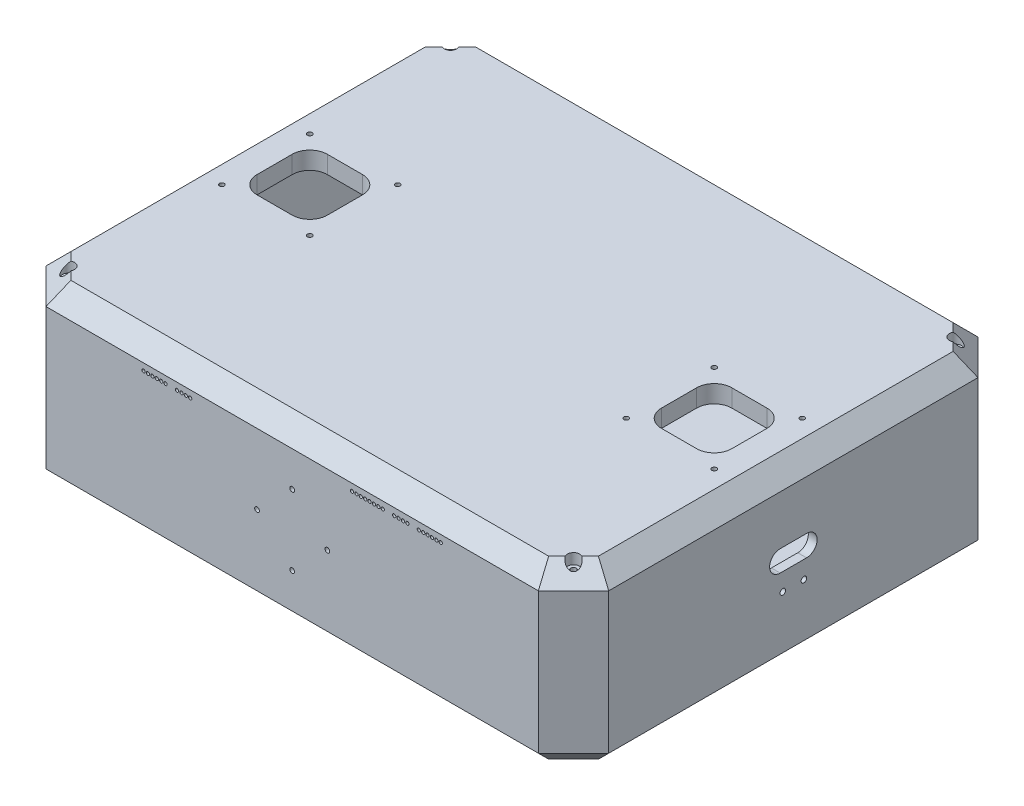
from build123d import *

# Parameters (mm, degrees)
BOSS_EXTRUDE1_DEPTH     = 50
CHAMFER1_SIZE           = 20
CHAMFER2_SIZE           = 10
SHELL1_T                = -5
CUT_EXTRUDE1_DEPTH      = 210.10523666326498
CUT_EXTRUDE1_DEPTH_BACK = 210.10523666326498
SKETCH3_R               = 1.3500000000000005
SKETCH3_R_2             = 1.3500000000000056
SKETCH3_R_3             = 1.3499999999999985
BOSS_EXTRUDE2_DEPTH     = 85
BOSS_EXTRUDE2_2_DEPTH   = 85
SKETCH4_W               = 8
SKETCH4_H               = 8
BOSS_EXTRUDE2_3_DEPTH   = 85
SKETCH5_W               = 6
SKETCH5_H               = 6
CUT_EXTRUDE2_DEPTH      = 8
CHAMFER3_SIZE           = 8
CHAMFER4_SIZE           = 8
CHAMFER5_SIZE           = 8
CHAMFER6_SIZE           = 0.5
CHAMFER7_SIZE           = 0.5
CHAMFER8_SIZE           = 0.5
BOSS_EXTRUDE4_DEPTH     = 8
SKETCH6_R               = 5
SKETCH6_R_2             = 5.000000000000004
SKETCH6_R_3             = 5.000000000000002
BOSS_EXTRUDE3_DEPTH     = 1.5
CHAMFER9_SIZE           = 0.5
SKETCH7_R               = 6
CUT_EXTRUDE3_DEPTH      = 343.5638626592129
CHAMFER10_SIZE          = 8
SKETCH9_R               = 1.6
CUT_EXTRUDE4_DEPTH      = 343.56386265921293
BOSS_EXTRUDE5_DEPTH     = 12
CHAMFER11_SIZE          = 8
FILLET1_R               = 1
SKETCH11_R              = 1.599999999999993
CUT_EXTRUDE6_DEPTH      = 223.09232314512823
CUT_EXTRUDE7_START      = 4
SKETCH11_3_R            = 3.500000000000021
SKETCH11_3_R_2          = 1.599999999999993
CUT_EXTRUDE7_DEPTH      = 6
SKETCH14_R              = 0.9250000000000028
SKETCH14_R_2            = 0.9250000000000008
CUT_EXTRUDE8_DEPTH      = 301.9983388658483
SKETCH15_R              = 1.3500000000000065
SKETCH15_R_2            = 1.3500000000000054
SKETCH15_R_3            = 1.3499999999999779
CUT_EXTRUDE9_DEPTH      = 10
FILLET2_R               = 10


# Read off the part's stored shape, not the designer's step: Intersect1
# Some blends are built 0.0001 mm under size
with BuildPart() as part:
    # Sketch1 → Boss-Extrude1 (new, symmetric)
    with BuildSketch(Plane(origin=(0, 0, 0), x_dir=(1, 0, 0), z_dir=(0, 1, 0))):
        Polygon((-159.99999999999997, 125.00000000000003), (160.00000000000003, 125.00000000000003), (160.0000000000001, -124.99999999999997), (-159.99999999999994, -124.99999999999997), align=None)
    extrude(amount=BOSS_EXTRUDE1_DEPTH, both=True)

    # Chamfer1
    chamfer1_edges = [part.edges().sort_by_distance(p)[0] for p in [
        (160.0000000000001, 0, 124.99999999999997),
        (-159.99999999999994, 0, 124.99999999999997),
        (-159.99999999999997, 0, -125.00000000000003),
        (160.00000000000003, 0, -125.00000000000003),
    ]]
    chamfer(chamfer1_edges, length=CHAMFER1_SIZE)

    # Chamfer2
    chamfer2_edges = [part.edges().sort_by_distance(p)[0] for p in [
        (-159.99999999999994, -50, -2.842e-14),
        (-159.99999999999994, 50, -2.842e-14),
        (160.00000000000006, -50, -2.842e-14),
        (8.527e-14, -50, 124.99999999999997),
        (2.842e-14, -50, -125.00000000000003),
        (150.0000000000001, -50.000000000000014, 114.99999999999999),
        (150.00000000000006, -50.000000000000014, -115.00000000000004),
        (-149.99999999999994, -50, 114.99999999999997),
        (-150, -50, -115.00000000000006),
        (2.842e-14, 50, -125.00000000000003),
        (160.00000000000006, 50, -2.842e-14),
        (8.527e-14, 50, 124.99999999999997),
        (150.0000000000001, 50, 114.99999999999999),
        (150.00000000000006, 50, -115.00000000000004),
        (-149.99999999999994, 50.000000000000014, 114.99999999999997),
        (-150, 50.000000000000014, -115.00000000000006),
    ]]
    chamfer(chamfer2_edges, length=CHAMFER2_SIZE)


with BuildPart() as body_2:
    # Intersect1: the piece on the far side of the plane
    add(part.part)
    split(bisect_by=Plane(origin=(0, 40, 0), x_dir=(1, 0, 0), z_dir=(0, 1, 0)), keep=Keep.BOTTOM)

    # Shell1
    shell1_openings = [body_2.faces().sort_by_distance(p)[0] for p in [
        (0, 40, 0),
    ]]
    offset(amount=SHELL1_T, openings=shell1_openings, kind=Kind.INTERSECTION)

    # Sketch3 → Cut-Extrude1 (cut, two sides: drawn at the far end of the back side and taken through both)
    with BuildSketch(Plane.XY.offset(-CUT_EXTRUDE1_DEPTH_BACK)):
        with Locations((3.96e-15, 20.000000000000004)):
            Circle(SKETCH3_R)
        with Locations((20.000000000000004, -3.47e-15)):
            Circle(SKETCH3_R_2)
        with Locations((2.98e-15, -20.000000000000004)):
            Circle(SKETCH3_R)
        with Locations((-19.999999999999996, 1.276e-14)):
            Circle(SKETCH3_R_3)
    extrude(amount=CUT_EXTRUDE1_DEPTH + CUT_EXTRUDE1_DEPTH_BACK, mode=Mode.SUBTRACT)


with BuildPart() as part_1:
    add(part.part)

    # Intersect1
    split(bisect_by=Plane(origin=(0, 40, 0), x_dir=(1, 0, 0), z_dir=(0, 1, 0)), keep=Keep.TOP)

    # Sketch11 → Cut-Extrude6 (cut, through all)
    with BuildSketch(Plane(origin=(0, 40, 0), x_dir=(1, 0, 0), z_dir=(0, 1, 0))):
        with Locations(Location((143.6360389693211, 108.63603896932109, 0), (0, 0, 173.682187454))):
            Circle(SKETCH11_R)
        with Locations(Location((143.6360389693211, -108.63603896932109, 0), (0, 0, 83.682187454))):
            Circle(SKETCH11_R)
        with Locations(Location((-143.6360389693211, -108.63603896932109, 0), (0, 0, 96.317812547))):
            Circle(SKETCH11_R)
        with Locations(Location((-143.6360389693211, 108.63603896932109, 0), (0, 0, 6.317812547))):
            Circle(SKETCH11_R)
    extrude(amount=CUT_EXTRUDE6_DEPTH, mode=Mode.SUBTRACT)

    # Sketch11<3> → Cut-Extrude7 (cut)
    # profile 1 of 4: a face of its own
    with BuildSketch(Plane(origin=(0, 40, 0), x_dir=(1, 0, 0), z_dir=(0, 1, 0)).offset(CUT_EXTRUDE7_START)):
        with Locations(Location((-143.6360389693211, 108.63603896932109, 0), (0, 0, 270))):
            Circle(SKETCH11_3_R)
        with Locations(Location((-143.6360389693211, 108.63603896932109, 0), (0, 0, 270))):
            Circle(SKETCH11_3_R_2, mode=Mode.SUBTRACT)
    # profile 2 of 4: a face of its own
    with BuildSketch(Plane(origin=(0, 40, 0), x_dir=(1, 0, 0), z_dir=(0, 1, 0)).offset(CUT_EXTRUDE7_START)):
        with Locations(Location((143.6360389693211, 108.63603896932109, 0), (0, 0, 270))):
            Circle(SKETCH11_3_R)
        with Locations(Location((143.6360389693211, 108.63603896932109, 0), (0, 0, 270))):
            Circle(SKETCH11_3_R_2, mode=Mode.SUBTRACT)
    # profile 3 of 4: a face of its own
    with BuildSketch(Plane(origin=(0, 40, 0), x_dir=(1, 0, 0), z_dir=(0, 1, 0)).offset(CUT_EXTRUDE7_START)):
        with Locations(Location((143.6360389693211, -108.63603896932109, 0), (0, 0, 270))):
            Circle(SKETCH11_3_R)
        with Locations(Location((143.6360389693211, -108.63603896932109, 0), (0, 0, 270))):
            Circle(SKETCH11_3_R_2, mode=Mode.SUBTRACT)
    # profile 4 of 4: a face of its own
    with BuildSketch(Plane(origin=(0, 40, 0), x_dir=(1, 0, 0), z_dir=(0, 1, 0)).offset(CUT_EXTRUDE7_START)):
        with Locations(Location((-143.6360389693211, -108.63603896932109, 0), (0, 0, 270))):
            Circle(SKETCH11_3_R)
        with Locations(Location((-143.6360389693211, -108.63603896932109, 0), (0, 0, 270))):
            Circle(SKETCH11_3_R_2, mode=Mode.SUBTRACT)
    extrude(amount=CUT_EXTRUDE7_DEPTH, mode=Mode.SUBTRACT)

    # Sketch15 → Cut-Extrude9 (cut)
    with BuildSketch(Plane(origin=(0, 50, 0), x_dir=(1, 0, 0), z_dir=(0, 1, 0))):
        with Locations(Location((-140, 25.000000000000025, 0), (0, 0, 270))):
            Circle(SKETCH15_R)
        with Locations(Location((-140, -24.999999999999986, 0), (0, 0, 270))):
            Circle(SKETCH15_R)
        with Locations(Location((-90.00000000000003, 25.000000000000018, 0), (0, 0, 270))):
            Circle(SKETCH15_R_2)
        with Locations(Location((-90.00000000000003, -24.999999999999986, 0), (0, 0, 270))):
            Circle(SKETCH15_R_2)
        with Locations(Location((90, -24.999999999999968, 0), (0, 0, 270))):
            Circle(SKETCH15_R_2)
        with Locations(Location((140, -24.99999999999996, 0), (0, 0, 270))):
            Circle(SKETCH15_R_3)
        with Locations(Location((140, 25.000000000000025, 0), (0, 0, 270))):
            Circle(SKETCH15_R)
        with Locations(Location((90, 25.00000000000002, 0), (0, 0, 270))):
            Circle(SKETCH15_R_2)
        Polygon((-135, 20.000000000000018), (-95.00000000000001, 20.000000000000014), (-95.00000000000003, -19.999999999999986), (-135.00000000000003, -19.99999999999999), align=None)
        Polygon((95, 20.00000000000003), (135, 20.00000000000003), (135, -19.999999999999982), (95, -19.999999999999975), align=None)
    extrude(amount=-CUT_EXTRUDE9_DEPTH, mode=Mode.SUBTRACT)

    # Fillet2
    fillet2_edges = [part_1.edges().sort_by_distance(p)[0] for p in [
        (135, 45, -20.00000000000003),
        (135, 45, 19.999999999999982),
        (95, 45, 19.999999999999975),
        (95, 45, -20.00000000000003),
        (-95.00000000000001, 45, -20.000000000000014),
        (-95.00000000000003, 45, 19.999999999999986),
        (-135.00000000000003, 45, 19.99999999999999),
        (-135, 45, -20.000000000000018),
    ]]
    fillet(fillet2_edges, radius=FILLET2_R)


with BuildPart() as body_3:
    # Sketch4 → Boss-Extrude2 (new body)
    with BuildSketch(Plane(origin=(0, -45.00000000000001, 0), x_dir=(1, 0, 0), z_dir=(0, 1, 0))):
        Polygon((-23.999999999999993, 120.00000000000003), (-16, 120.00000000000003), (-15.999999999999993, 112.00000000000001), (-23.999999999999996, 112.00000000000001), align=None)
    extrude(amount=BOSS_EXTRUDE2_DEPTH)


with BuildPart() as body_4:
    # Sketch4 → Boss-Extrude2 2 (new body)
    with BuildSketch(Plane(origin=(0, -45.00000000000001, 0), x_dir=(1, 0, 0), z_dir=(0, 1, 0))):
        Polygon((16, 120.00000000000003), (24.000000000000007, 120.00000000000003), (24.000000000000007, 112.00000000000001), (16.000000000000007, 112.00000000000001), align=None)
    extrude(amount=BOSS_EXTRUDE2_2_DEPTH)


with BuildPart() as body_5:
    # Sketch4 → Boss-Extrude2 3 (new body)
    with BuildSketch(Plane(origin=(0, -45.00000000000001, 0), x_dir=(1, 0, 0), z_dir=(0, 1, 0))):
        with Locations((0, 116.00000000000001)):
            Rectangle(SKETCH4_W, SKETCH4_H)
    extrude(amount=BOSS_EXTRUDE2_3_DEPTH)


with BuildPart() as cut_extrude2_tool:
    # Sketch5 → Cut-Extrude2 (new body)
    with BuildSketch(Plane.XY.offset(-120.00000000000003)):
        with Locations((-19.999999999999993, 1.044e-14)):
            Rectangle(SKETCH5_W, SKETCH5_H)
        with Locations((2.44e-15, -20.000000000000004)):
            Rectangle(SKETCH5_W, SKETCH5_H)
        Polygon((-2.9999999999999933, 23.000000000000007), (3.0000000000000067, 23.000000000000007), (3.0000000000000075, 17.000000000000004), (-2.999999999999993, 17.000000000000004), align=None)
        with Locations((20.000000000000004, -4.66e-15)):
            Rectangle(SKETCH5_W, SKETCH5_H)
    extrude(amount=CUT_EXTRUDE2_DEPTH)


with BuildPart() as body_3_1:
    add(body_3.part)

    # Cut-Extrude2: cut by cut_extrude2_tool
    add(cut_extrude2_tool.part, mode=Mode.SUBTRACT)

    # Chamfer3
    chamfer3_edges = [body_3_1.edges().sort_by_distance(p)[0] for p in [
        (-19.999999999999993, 3.0000000000000107, -112.00000000000003),
        (-19.999999999999993, -2.99999999999999, -112.00000000000003),
    ]]
    chamfer(chamfer3_edges, length=CHAMFER3_SIZE - 0.0001)  # a hair under: the kernel refuses the full size

    # Chamfer6
    chamfer6_edges = [body_3_1.edges().sort_by_distance(p)[0] for p in [
        (-15.999999999999993, -2.500000000000007, -112.00000000000001),
        (-23.999999999999996, -2.500000000000007, -112.00000000000001),
    ]]
    chamfer(chamfer6_edges, length=CHAMFER6_SIZE)


with BuildPart() as body_4_1:
    add(body_4.part)

    # Cut-Extrude2: cut by cut_extrude2_tool
    add(cut_extrude2_tool.part, mode=Mode.SUBTRACT)

    # Chamfer5
    chamfer5_edges = [body_4_1.edges().sort_by_distance(p)[0] for p in [
        (20.000000000000004, 2.9999999999999956, -112.00000000000003),
        (20.000000000000004, -3.0000000000000044, -112.00000000000003),
    ]]
    chamfer(chamfer5_edges, length=CHAMFER5_SIZE - 0.0001)  # a hair under: the kernel refuses the full size

    # Chamfer8
    chamfer8_edges = [body_4_1.edges().sort_by_distance(p)[0] for p in [
        (24.000000000000007, -2.500000000000007, -112.00000000000001),
        (16.000000000000007, -2.500000000000007, -112.00000000000001),
    ]]
    chamfer(chamfer8_edges, length=CHAMFER8_SIZE)


with BuildPart() as body_5_1:
    add(body_5.part)

    # Cut-Extrude2: cut by cut_extrude2_tool
    add(cut_extrude2_tool.part, mode=Mode.SUBTRACT)

    # Chamfer4
    chamfer4_edges = [body_5_1.edges().sort_by_distance(p)[0] for p in [
        (2.66e-15, -17.000000000000004, -112.00000000000003),
        (2.66e-15, -23.000000000000004, -112.00000000000003),
        (7.55e-15, 17.000000000000004, -112.00000000000003),
        (6.66e-15, 23.000000000000007, -112.00000000000003),
    ]]
    chamfer(chamfer4_edges, length=CHAMFER4_SIZE - 0.0001)  # a hair under: the kernel refuses the full size

    # Chamfer7
    chamfer7_edges = [body_5_1.edges().sort_by_distance(p)[0] for p in [
        (4, -2.500000000000007, -112.00000000000001),
        (-4, -2.500000000000007, -112.00000000000001),
    ]]
    chamfer(chamfer7_edges, length=CHAMFER7_SIZE)


with BuildPart() as body_6:
    # Sketch8 → Boss-Extrude4 (new body)
    with BuildSketch(Plane.XY.offset(-120.00000000000003)):
        Polygon((-16.5, 4.0000000000000036), (16.5, 4.0000000000000036), (16.5, 2.0000000000000084), (-16.5, 2.0000000000000036), align=None)
    extrude(amount=BOSS_EXTRUDE4_DEPTH)


with BuildPart() as body_7:
    # Mirror1: mirrored copy
    add(body_3_1.part.mirror(Plane.XY))


with BuildPart() as body_8:
    # Mirror1 2: mirrored copy
    add(body_5_1.part.mirror(Plane.XY))


with BuildPart() as body_9:
    # Mirror1 3: mirrored copy
    add(body_4_1.part.mirror(Plane.XY))


with BuildPart() as body_10:
    # Mirror1 4: mirrored copy
    add(body_6.part.mirror(Plane.XY))


with BuildPart() as body_2_1:
    add(body_2.part)

    # Combine4: union body 3, body 5, body 4, body 7, body 8, body 9, body 6, body 10
    add(body_3_1.part)
    add(body_5_1.part)
    add(body_4_1.part)
    add(body_7.part)
    add(body_8.part)
    add(body_9.part)
    add(body_6.part)
    add(body_10.part)

    # Sketch6 → Boss-Extrude3 (add)
    with BuildSketch(Plane(origin=(0, -45.00000000000001, 0), x_dir=(1, 0, 0), z_dir=(0, 1, 0))):
        with Locations(Location((0, 0, 0), (0, 0, 270))):
            Circle(SKETCH6_R)
        with Locations(Location((80, 0, 0), (0, 0, 270))):
            Circle(SKETCH6_R_2)
        with Locations(Location((0, 80, 0), (0, 0, 270))):
            Circle(SKETCH6_R_3)
        with Locations(Location((-80, 0, 0), (0, 0, 270))):
            Circle(SKETCH6_R_2)
        with Locations(Location((0, -80, 0), (0, 0, 270))):
            Circle(SKETCH6_R_3)
    extrude(amount=BOSS_EXTRUDE3_DEPTH)

    # Chamfer9
    chamfer9_edges = [body_2_1.edges().sort_by_distance(p)[0] for p in [
        (1.53e-15, -43.50000000000001, -5),
        (80, -43.50000000000001, -5.000000000000004),
        (1.53e-15, -43.50000000000001, -85),
        (-80, -43.50000000000001, -5.000000000000004),
        (1.53e-15, -43.50000000000001, 75),
    ]]
    chamfer(chamfer9_edges, length=CHAMFER9_SIZE)

    # Sketch7 → Cut-Extrude3 (cut, through all)
    with BuildSketch(Plane(origin=(-154.99999999999994, 0, 1.721e-14), x_dir=(-1.1e-16, 0, -1), z_dir=(1, 0, -1.1e-16))):
        with Locations((1.721e-14, 7.999999999999998)):
            Circle(SKETCH7_R)
    extrude(amount=-CUT_EXTRUDE3_DEPTH, mode=Mode.SUBTRACT)

    # Chamfer10
    chamfer10_edges = [body_2_1.edges().sort_by_distance(p)[0] for p in [
        (-10, 2.0000000000000044, 120.00000000000003),
        (10, 2.0000000000000075, 120.00000000000003),
        (10, 2.0000000000000075, -120.00000000000003),
        (-10, 2.0000000000000044, -120.00000000000003),
    ]]
    chamfer(chamfer10_edges, length=CHAMFER10_SIZE - 0.0001)  # a hair under: the kernel refuses the full size

    # Sketch9 → Cut-Extrude4 (cut, through all)
    with BuildSketch(Plane.ZY.offset(-155.00000000000009)):
        with Locations((-5.999999999999999, -9.999999999999998)):
            Circle(SKETCH9_R)
        with Locations((6.000000000000001, -10)):
            Circle(SKETCH9_R)
        with BuildLine():
            Line((7.5, -5.2e-15), (-7.499999999999998, -5.2e-15))
            ThreePointArc((-7.499999999999998, -5.2e-15), (-13.500000000000007, 5.999999999999997), (-7.5, 12.000000000000004))
            Line((-7.5, 12.000000000000004), (7.500000000000002, 12.000000000000004))
            ThreePointArc((7.500000000000002, 12.000000000000004), (13.500000000000004, 5.999999999999995), (7.5, -5.2e-15))
        make_face()
    extrude(amount=-CUT_EXTRUDE4_DEPTH, mode=Mode.SUBTRACT)


with BuildPart() as body_3_2:
    # Sketch10 → Boss-Extrude5 (new body)
    with BuildSketch(Plane(origin=(0, 40, 0), x_dir=(1, 0, 0), z_dir=(0, 1, 0))):
        with BuildLine():
            Line((146.4644660940673, 111.46446609406729), (143.6360389693211, 114.29289321881348))
            Line((143.6360389693211, 114.29289321881348), (137.97918471982874, 108.6360389693211))
            Line((137.97918471982874, 108.6360389693211), (140.80761184457492, 105.80761184457491))
            Line((140.80761184457492, 105.80761184457491), (142.04504871165136, 107.04504871165135))
            ThreePointArc((142.04504871165136, 107.04504871165135), (142.04504871165136, 110.22702922699084), (145.22702922699085, 110.22702922699082))
            Line((145.22702922699085, 110.22702922699082), (146.4644660940673, 111.46446609406728))
        make_face()
        with BuildLine():
            Line((149.2928932188135, 108.63603896932108), (146.4644660940673, 111.46446609406729))
            Line((146.4644660940673, 111.46446609406728), (145.22702922699085, 110.22702922699082))
            ThreePointArc((145.22702922699085, 110.22702922699082), (145.7147679174715, 109.49707669214254), (145.8860389693211, 108.63603896932109))
            ThreePointArc((145.8860389693211, 108.63603896932109), (144.49707669214257, 106.5573100211707), (142.04504871165136, 107.04504871165135))
            Line((142.04504871165136, 107.04504871165135), (140.80761184457492, 105.80761184457491))
            Line((140.80761184457492, 105.80761184457491), (143.6360389693211, 102.97918471982871))
            Line((143.6360389693211, 102.97918471982871), (149.2928932188135, 108.63603896932109))
        make_face()
    extrude(amount=-BOSS_EXTRUDE5_DEPTH)

    # Chamfer11
    # the kernel refuses this chamfer: 8 mm, written as the material it takes off along each edge
    with BuildSketch(Plane(origin=(158.18367480814328, 28, -88.43154888100646), x_dir=(0.7068394360706753, -0.027495876610586494, -0.7068394360706717), z_dir=(-0.7071067811865458, 0, -0.7071067811865493))) as chamfer11_piece_1:
        Polygon((CHAMFER11_SIZE * 0.999621916911, -CHAMFER11_SIZE * 0.0274958766106), (-CHAMFER11_SIZE * 0.0274958766106, -CHAMFER11_SIZE * 0.999621916911), (0, 0), align=None)
    extrude(amount=49.146927807454574, mode=Mode.SUBTRACT)

    # Fillet1
    fillet1_edges = [body_3_2.edges().sort_by_distance(p)[0] for p in [
        (137.97918471982874, 37.99999999999881, -108.6360389693211),
        (143.6360389693211, 37.99999999999881, -102.97918471982871),
        (140.80761184457666, 35.99999999999763, -105.80761184457663),
        (146.46446609406712, 31.9999999999973, -105.80761184457471),
        (140.80761184457472, 31.99999999999729, -111.46446609406709),
    ]]
    fillet(fillet1_edges, radius=FILLET1_R)


with BuildPart() as body_4_2:
    # Mirror2: mirrored copy
    add(body_3_2.part.mirror(Plane.XY))


with BuildPart() as body_5_2:
    # Mirror3: mirrored copy
    add(body_3_2.part.mirror(Plane(origin=(0, 0, 0), x_dir=(0, 0, 1), z_dir=(1, 0, 0))))


with BuildPart() as body_6_2:
    # Mirror3 2: mirrored copy
    add(body_4_2.part.mirror(Plane(origin=(0, 0, 0), x_dir=(0, 0, 1), z_dir=(1, 0, 0))))


with BuildPart() as body_2_2:
    add(body_2_1.part)

    # Combine5: union body 3 2, body 4 2, body 6 2, body 5 2
    add(body_3_2.part)
    add(body_4_2.part)
    add(body_6_2.part)
    add(body_5_2.part)

    # Sketch14 → Cut-Extrude8 (cut, through all)
    with BuildSketch(Plane.XY.offset(124.99999999999997)):
        with Locations((34, 35.99999999999999)):
            Circle(SKETCH14_R)
        with Locations((36.50000000000001, 35.99999999999999)):
            Circle(SKETCH14_R)
        with Locations((39, 35.99999999999999)):
            Circle(SKETCH14_R)
        with Locations((41.5, 35.99999999999999)):
            Circle(SKETCH14_R)
        with Locations((44.00000000000001, 35.99999999999999)):
            Circle(SKETCH14_R)
        with Locations((46.5, 35.99999999999999)):
            Circle(SKETCH14_R)
        with Locations((49, 35.99999999999999)):
            Circle(SKETCH14_R)
        with Locations((51.50000000000001, 35.99999999999999)):
            Circle(SKETCH14_R)
        with Locations((58.00000000000001, 35.99999999999999)):
            Circle(SKETCH14_R)
        with Locations((60.50000000000001, 35.99999999999999)):
            Circle(SKETCH14_R)
        with Locations((63, 35.99999999999999)):
            Circle(SKETCH14_R_2)
        with Locations((65.5, 35.99999999999999)):
            Circle(SKETCH14_R_2)
        with Locations((72.00000000000001, 35.99999999999999)):
            Circle(SKETCH14_R_2)
        with Locations((74.50000000000001, 35.99999999999999)):
            Circle(SKETCH14_R_2)
        with Locations((77.00000000000001, 35.99999999999999)):
            Circle(SKETCH14_R_2)
        with Locations((79.50000000000001, 35.99999999999999)):
            Circle(SKETCH14_R_2)
        with Locations((82.00000000000001, 35.99999999999999)):
            Circle(SKETCH14_R_2)
        with Locations((84.50000000000001, 35.99999999999999)):
            Circle(SKETCH14_R_2)
        with Locations((-84.50000000000001, 35.99999999999999)):
            Circle(SKETCH14_R_2)
        with Locations((-82.00000000000001, 35.99999999999999)):
            Circle(SKETCH14_R_2)
        with Locations((-79.50000000000001, 35.99999999999999)):
            Circle(SKETCH14_R_2)
        with Locations((-77.00000000000001, 35.99999999999999)):
            Circle(SKETCH14_R_2)
        with Locations((-74.50000000000001, 35.99999999999999)):
            Circle(SKETCH14_R_2)
        with Locations((-72.00000000000001, 35.99999999999999)):
            Circle(SKETCH14_R_2)
        with Locations((-65.5, 35.99999999999999)):
            Circle(SKETCH14_R_2)
        with Locations((-63, 35.99999999999999)):
            Circle(SKETCH14_R)
        with Locations((-60.50000000000001, 35.99999999999999)):
            Circle(SKETCH14_R)
        with Locations((-58.00000000000001, 35.99999999999999)):
            Circle(SKETCH14_R)
    extrude(amount=-CUT_EXTRUDE8_DEPTH, mode=Mode.SUBTRACT)


solid = Compound([part_1.part, body_2_2.part])
